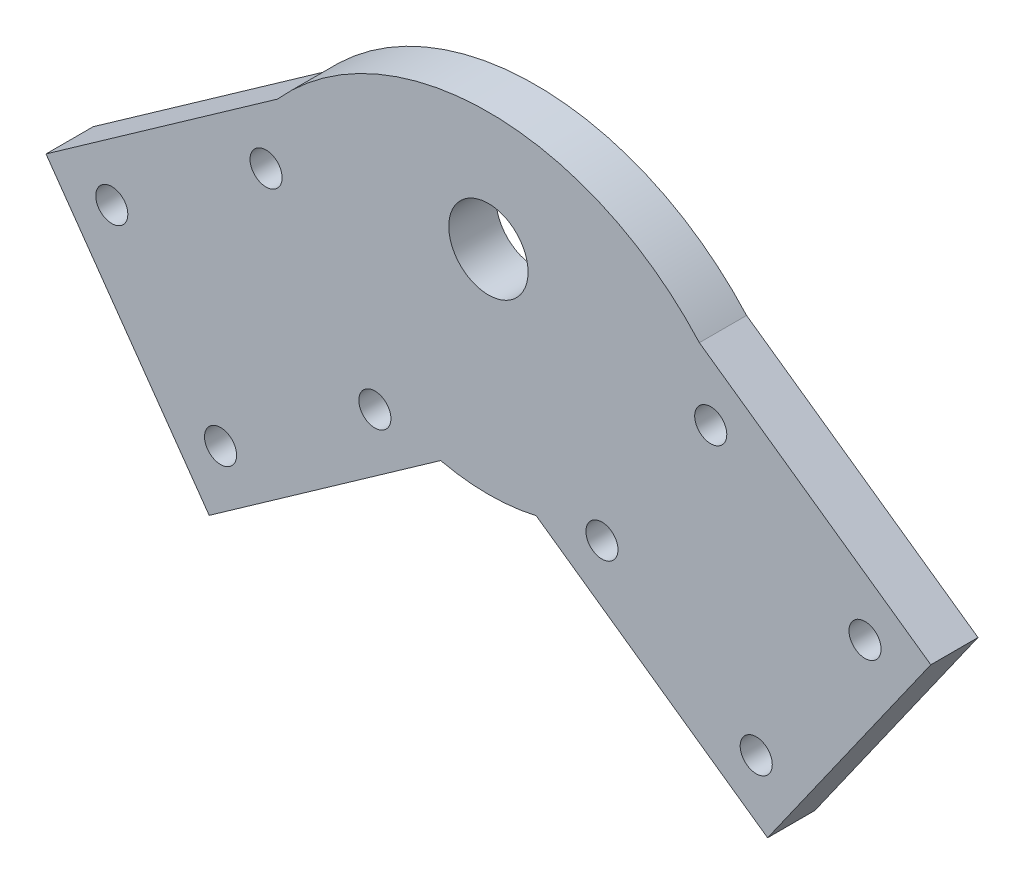
from build123d import *

# Parameters (mm, degrees)
SKETCH2_R            = 4.2
BOSS_EXTRUDE1_DEPTH  = 5
M3_CLEARANCE_HOLE1_D = 3.4


with BuildPart() as part:
    # Sketch2 → Boss-Extrude1 (new body)
    with BuildSketch(Plane.XY):
        with BuildLine():
            ThreePointArc((-5.061398723, -21.923326458), (0, -22.5), (5.061398723, -21.923326458))
            Line((5.061398723, -21.923326458), (29.57885851, -39.211882372))
            Line((29.57885851, -39.211882372), (46.867414424, -14.694422585))
            Line((46.867414424, -14.694422585), (22.349954637, 2.594133329))
            ThreePointArc((22.349954637, 2.594133329), (0, 12.582148727), (-22.349954637, 2.594133329))
            Line((-22.349954637, 2.594133329), (-46.867414424, -14.694422585))
            Line((-46.867414424, -14.694422585), (-29.57885851, -39.211882372))
            Line((-29.57885851, -39.211882372), (-5.061398723, -21.923326458))
        make_face()
        Circle(SKETCH2_R, mode=Mode.SUBTRACT)
    extrude(amount=BOSS_EXTRUDE1_DEPTH)

    # M3 Clearance Hole1 (through all)
    with Locations(Plane.XY.offset(5)):
        with Locations((-39.89974514, -15.899239897), (-28.374041198, -32.244213088), (-12.029068006, -20.718509146), (-23.554771949, -4.373535954), (23.554771949, -4.373535954), (28.374041198, -32.244213088), (39.89974514, -15.899239897), (12.029068006, -20.718509146)):
            Hole(M3_CLEARANCE_HOLE1_D / 2)


solid = part.part
